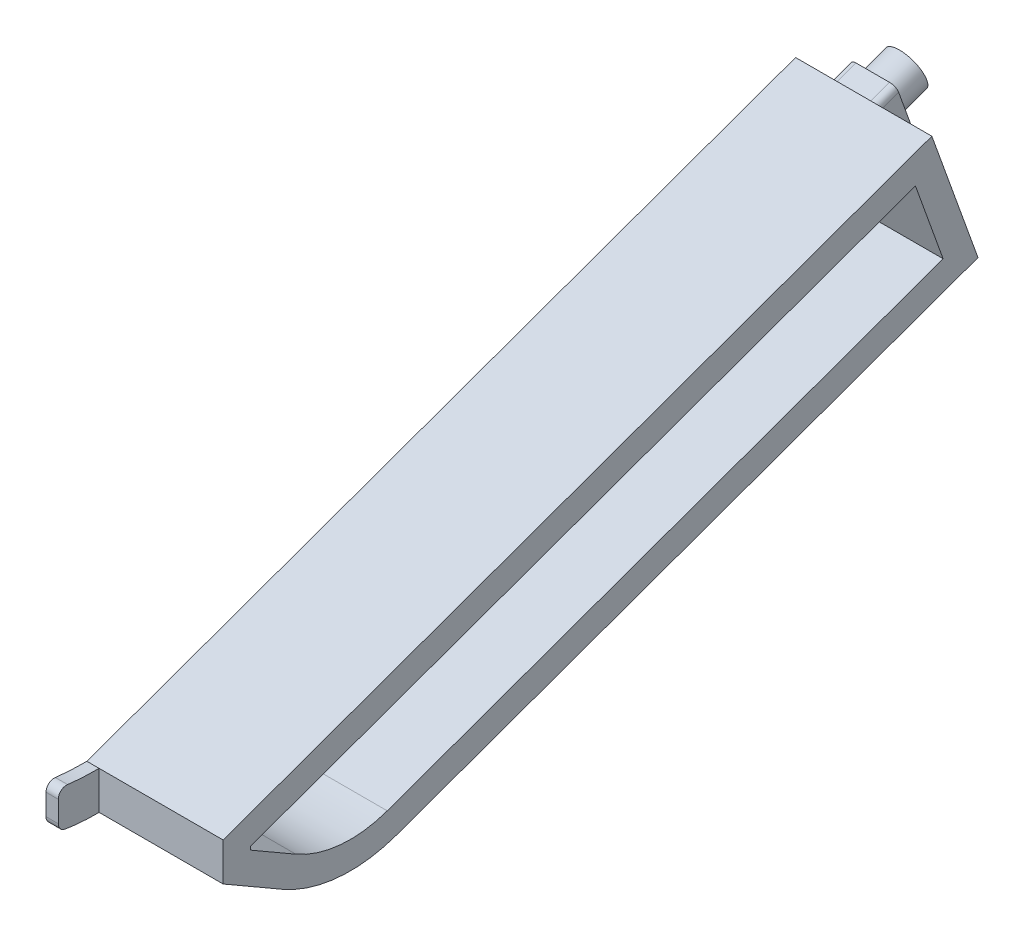
from build123d import *

# Parameters (mm, degrees)
BOSS_EXTRUDE1_DEPTH = 0.9
FILLET1_R           = 0.5
BOSS_EXTRUDE2_DEPTH = 10
BOSS_EXTRUDE3_DEPTH = 10
BOSS_EXTRUDE4_DEPTH = 10
CUT_EXTRUDE2_DEPTH  = 61.26562122547703
FILLET2_R           = 10
CUT_EXTRUDE3_DEPTH  = 61.26562122547703
CUT_EXTRUDE4_DEPTH  = 61.265621208883815
FILLET3_R           = 0.6
SKETCH10_R          = 2.1
BOSS_EXTRUDE5_DEPTH = 3
SKETCH11_R          = 1.5
BOSS_EXTRUDE6_DEPTH = 2
BOSS_EXTRUDE7_DEPTH = 3
SKETCH14_R          = 1.5000000000000002
BOSS_EXTRUDE8_DEPTH = 2
FILLET4_R           = 0.5


# Read off the part's stored shape, not the designer's step: Split1
with BuildPart() as part:
    # Sketch1 → Boss-Extrude1 (new body)
    with BuildSketch(Plane(origin=(0, 0, 0), x_dir=(0, 0, -1), z_dir=(1, 0, 0))):
        with BuildLine():
            Line((0, 2.8), (0, 0))
            add(Edge.make_bspline(
                [(0, 0), (-5.0882686653691644, 0), (-6.101472647573343, 1.7391212131518174), (-7.000000000000001, 5.128421052631583)],
                knots=[0, 0, 0, 0, 1, 1, 1, 1], degree=3))
            add(Edge.make_bspline(
                [(-7.000000000000001, 5.128421052631583), (-4.554183023047009, 3.433770739772326), (-3.654213934684202, 2.799999999999996), (0, 2.8)],
                knots=[0, 0, 0, 0, 1, 1, 1, 1], degree=3))
        make_face()
    extrude(amount=BOSS_EXTRUDE1_DEPTH)

    # Fillet1
    fillet1_edges = [part.edges().sort_by_distance(p)[0] for p in [
        (0.45, 5.128421052631583, 7.000000000000001),
    ]]
    fillet(fillet1_edges, radius=FILLET1_R)

    # Sketch3 → Boss-Extrude2 (add)
    with BuildSketch(Plane(origin=(0, 0, 0), x_dir=(0, 0, -1), z_dir=(1, 0, 0))):
        Polygon((0, 0), (40, 0), (40, 10), (20, 9.999999999999998), (0, 2.8), align=None)
    extrude(amount=BOSS_EXTRUDE2_DEPTH)

    # Sketch5 → Boss-Extrude3 (add)
    with BuildSketch(Plane(origin=(0, 0, 0), x_dir=(0, 0, -1), z_dir=(1, 0, 0))):
        Polygon((0, 0), (20.000000000000004, -11.54700538379255), (40, -11.547005383792548), (40, 0), align=None)
    extrude(amount=BOSS_EXTRUDE3_DEPTH)

    # Sketch6 → Boss-Extrude4 (add)
    with BuildSketch(Plane(origin=(10, 0, 0), x_dir=(0, 0, -1), z_dir=(1, 0, 0))):
        Polygon((8.351482323931023, -4.821730567853972), (55.39585291736738, 12.114242845783108), (52.00865823463995, 21.523116964470375), (20, 9.999999999999998), align=None)
    extrude(amount=-BOSS_EXTRUDE4_DEPTH)

    # Sketch7 → Cut-Extrude2 (cut, through all)
    with BuildSketch(Plane(origin=(10, 0, 0), x_dir=(0, 0, -1), z_dir=(1, 0, 0))):
        Polygon((40, 6.571735795530855), (-6.396657859934056, -10.1310610340454), (25.03138273349842, -20.31963634568749), (52.56184703999606, -5.85197020171655), align=None)
    extrude(amount=-CUT_EXTRUDE2_DEPTH, mode=Mode.SUBTRACT)

    # Fillet2
    fillet2_edges = [part.edges().sort_by_distance(p)[0] for p in [
        (5, -4.821730567853985, -8.351482323931002),
    ]]
    fillet(fillet2_edges, radius=FILLET2_R)

    # Sketch8 → Cut-Extrude3 (cut, through all)
    with BuildSketch(Plane(origin=(10, 0, 0), x_dir=(0, 0, -1), z_dir=(1, 0, 0))):
        with BuildLine():
            Line((2, 1.15470053837925), (5.3316294573154766, -0.7688166256419326))
            ThreePointArc((5.3316294573154766, -0.7688166256419326), (8.6203969477251, -1.8089349449339256), (12.041385203497414, -1.3677126903162435))
            Line((12.041385203497414, -1.3677126903162435), (52.83663915708444, 13.318578732975077))
            Line((52.83663915708444, 13.318578732975077), (50.80432234744798, 18.963903204187442))
            Line((50.80432234744798, 18.963903204187442), (2, 1.394347159106174))
            Line((2, 1.394347159106174), (2, 1.15470053837925))
        make_face()
    extrude(amount=-CUT_EXTRUDE3_DEPTH, mode=Mode.SUBTRACT)

    # Sketch9 → Cut-Extrude4 (cut, through all)
    with BuildSketch(Plane.ZY):
        Polygon((3.0000000000000013, -0.988739395943905), (3.0000000000000004, 5.799008427986812), (9.091562908025708, 5.799008427986812), (9.091562908025708, -1.8536705996620422), align=None)
    extrude(amount=-CUT_EXTRUDE4_DEPTH, mode=Mode.SUBTRACT)

    # Fillet3
    fillet3_edges = [part.edges().sort_by_distance(p)[0] for p in [
        (0.45, 0.2958164494648414, 3.0000000000000013),
        (0.45, 3.0492242349736607, 3.000000000000001),
    ]]
    fillet(fillet3_edges, radius=FILLET3_R)

    # Sketch10 → Boss-Extrude5 (add)
    with BuildSketch(Plane(origin=(0, 19.04436342339395, -52.90100950942748), x_dir=(-1, 0, 0), z_dir=(0, 0.33871946827274263, -0.9408874118687265))):
        with Locations(Location((-5, -2.365515246767623, 0), (0, 0, 270))):
            Circle(SKETCH10_R)
    extrude(amount=BOSS_EXTRUDE5_DEPTH)

    # Sketch11 → Boss-Extrude6 (add)
    with BuildSketch(Plane(origin=(0, 20.060521828212188, -55.72367174503367), x_dir=(-1, 0, 0), z_dir=(0, 0.33871946827274263, -0.9408874118687265))):
        with Locations(Location((-5, -2.365515246767633, 0), (0, 0, 90))):
            Circle(SKETCH11_R)
    extrude(amount=BOSS_EXTRUDE6_DEPTH)


with BuildPart() as body_2:
    # Split1: the piece on the far side of the plane
    add(part.part)
    split(bisect_by=Plane(origin=(0, 19.044363423, -52.901009509), x_dir=(1, 0, 0), z_dir=(0, 0.33871946827274285, -0.9408874118687265)), keep=Keep.BOTTOM)


with BuildPart() as part_1:
    add(part.part)

    # Split1
    split(bisect_by=Plane(origin=(0, 19.044363423, -52.901009509), x_dir=(1, 0, 0), z_dir=(0, 0.33871946827274285, -0.9408874118687265)), keep=Keep.TOP)


with BuildPart() as body_3:
    # Sketch13 → Boss-Extrude7 (new body)
    with BuildSketch(Plane(origin=(0, 19.04436342339395, -52.90100950942748), x_dir=(-1, 0, 0), z_dir=(0, 0.33871946827274263, -0.9408874118687265))):
        Polygon((-3.4648232278140823, -4.097926860674667), (6e-17, -4.097926860674667), (4e-17, -0.6331036328605839), (-3.4648232278140823, -0.6331036328605846), align=None)
    extrude(amount=BOSS_EXTRUDE7_DEPTH)


with BuildPart() as body_4:
    # Sketch14 → Boss-Extrude8 (new body)
    with BuildSketch(Plane(origin=(0, 20.060521828212188, -55.72367174503367), x_dir=(-1, 0, 0), z_dir=(0, 0.33871946827274263, -0.9408874118687265))):
        with Locations(Location((-1.7324116139070413, -2.3655152467676324, 0), (0, 0, 90))):
            Circle(SKETCH14_R)
    extrude(amount=BOSS_EXTRUDE8_DEPTH)


with BuildPart() as body_2_1:
    add(body_2.part)

    # Combine1: union body 3, body 4
    add(body_3.part)
    add(body_4.part)

    # Fillet4
    fillet4_edges = [body_2_1.edges().sort_by_distance(p)[0] for p in [
        (-6e-17, 15.69675482783554, -55.70038823449888),
        (-4e-17, 18.95676338723618, -54.526785153114645),
        (3.4648232278140823, 18.95676338723618, -54.526785153114645),
        (3.4648232278140823, 15.69675482783554, -55.70038823449888),
    ]]
    fillet(fillet4_edges, radius=FILLET4_R)


solid = body_2_1.part
